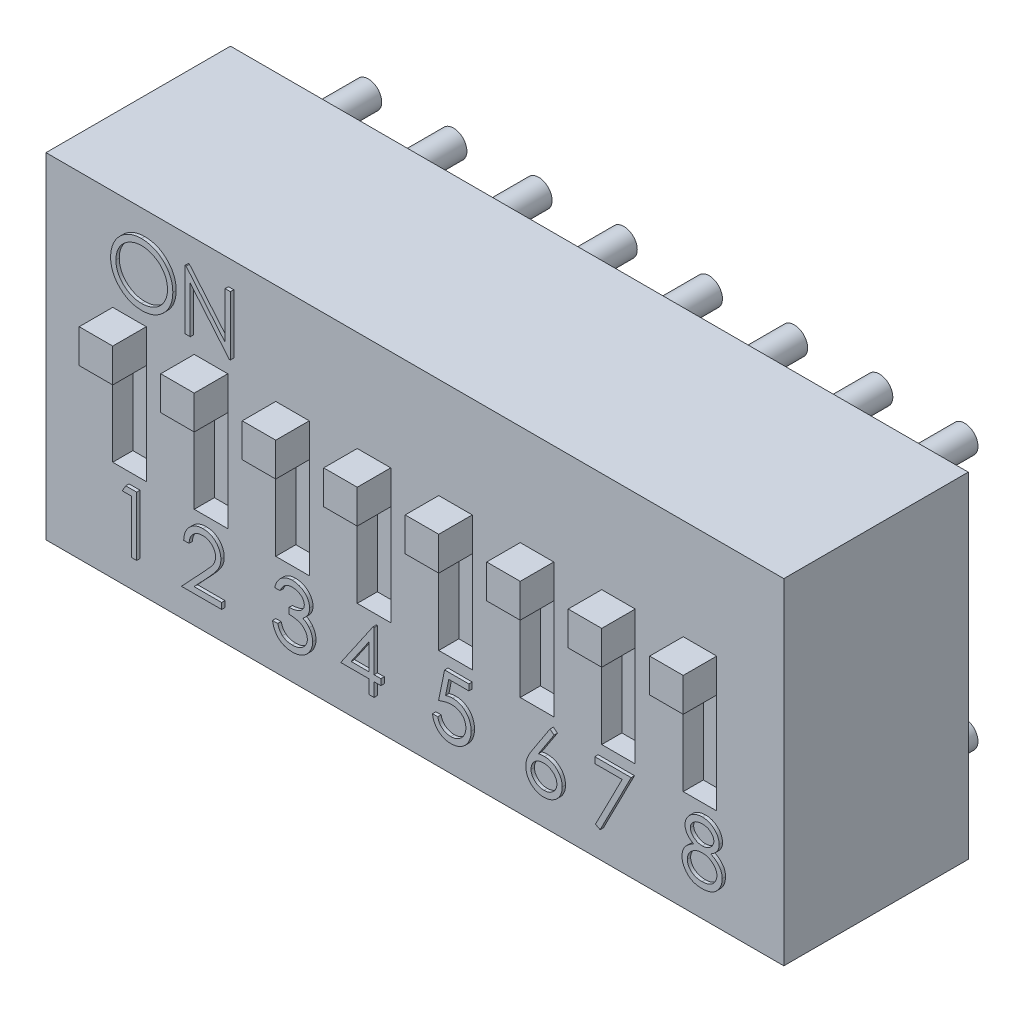
from build123d import *

# Parameters (mm, degrees)
SKETCH_1_W          = 22
SKETCH_1_H          = 10
EXTRUDE_1_DEPTH     = 5.5
SKETCH_42_W         = 1
SKETCH_42_H         = 4
CUT_EXTRUDE_1_DEPTH = 0.6
SKETCH_43_W         = 1
SKETCH_43_H         = 1.00419659
EXTRUDE_42_DEPTH    = 1.6
WRAP_1_DEPTH        = 0.1
SKETCH_45_R         = 0.4
EXTRUDE_43_DEPTH    = 2


# Read off the part's stored shape, not the designer's step: 包覆1
with BuildPart() as part:
    # 草图1 → 凸台-拉伸1 (new body)
    with BuildSketch(Plane.XY.offset(6.5)):
        with Locations((11, 5)):
            Rectangle(SKETCH_1_W, SKETCH_1_H)
    extrude(amount=-EXTRUDE_1_DEPTH)

    # 草图42 → 切除-拉伸1 (cut)
    with BuildSketch(Plane.XY.offset(6.5)):
        with Locations((12.21, 5)):
            Rectangle(SKETCH_42_W, SKETCH_42_H)
        with Locations((17.07, 5)):
            Rectangle(SKETCH_42_W, SKETCH_42_H)
        with Locations((19.5, 5)):
            Rectangle(SKETCH_42_W, SKETCH_42_H)
        with Locations((2.49, 5)):
            Rectangle(SKETCH_42_W, SKETCH_42_H)
        with Locations((4.92, 5)):
            Rectangle(SKETCH_42_W, SKETCH_42_H)
        with Locations((7.35, 5)):
            Rectangle(SKETCH_42_W, SKETCH_42_H)
        with Locations((9.78, 5)):
            Rectangle(SKETCH_42_W, SKETCH_42_H)
        with Locations((14.64, 5)):
            Rectangle(SKETCH_42_W, SKETCH_42_H)
    extrude(amount=-CUT_EXTRUDE_1_DEPTH, mode=Mode.SUBTRACT)

    # 草图43 → 凸台-拉伸42 (add)
    with BuildSketch(Plane.XY.offset(5.9)):
        with Locations((2.49, 6.497901705)):
            Rectangle(SKETCH_43_W, SKETCH_43_H)
        with Locations((4.92, 6.497901705)):
            Rectangle(SKETCH_43_W, SKETCH_43_H)
        with Locations((7.35, 6.497901705)):
            Rectangle(SKETCH_43_W, SKETCH_43_H)
        with Locations((9.78, 6.497901705)):
            Rectangle(SKETCH_43_W, SKETCH_43_H)
        with Locations((12.21, 6.497901705)):
            Rectangle(SKETCH_43_W, SKETCH_43_H)
        with Locations((14.64, 6.497901705)):
            Rectangle(SKETCH_43_W, SKETCH_43_H)
        with Locations((17.07, 6.497901705)):
            Rectangle(SKETCH_43_W, SKETCH_43_H)
        with Locations((19.5, 6.497901705)):
            Rectangle(SKETCH_43_W, SKETCH_43_H)
    extrude(amount=EXTRUDE_42_DEPTH)

    # 包覆1 outline → 包覆1 (add)
    # profile 1 of 10: a face of its own
    with BuildSketch(Plane.XY.offset(6.5)):
        with BuildLine():
            add(Edge.make_bspline(
                [(3.880857562, 8.378376083), (3.880076445, 8.346647529), (3.878536774, 8.284106873), (3.865348541, 8.192312359), (3.844665179, 8.104072207), (3.815134522, 8.019533723), (3.777223268, 7.938607728), (3.730528004, 7.86150716), (3.675524298, 7.788206742), (3.612927988, 7.719509487), (3.544690162, 7.65651473), (3.471498718, 7.601623074), (3.394999703, 7.554389091), (3.3142087, 7.516700493), (3.230197173, 7.486577343), (3.142213225, 7.466039311), (3.050669128, 7.452791475), (2.988242074, 7.451270239), (2.956511943, 7.450497032)],
                knots=[0, 0, 0, 0, 0.065226504, 0.128568996, 0.190320378, 0.251377989, 0.312387528, 0.373788704, 0.43643116, 0.500566755, 0.564686795, 0.627135518, 0.688455409, 0.749245746, 0.810155177, 0.871670926, 0.934773496, 1, 1, 1, 1], degree=3))
            add(Edge.make_bspline(
                [(2.942378217, 9.304841762), (2.975039445, 9.304014508), (3.039188792, 9.302389714), (3.133468601, 9.289952229), (3.22347486, 9.268435108), (3.309940763, 9.23977797), (3.391832065, 9.201549768), (3.469765157, 9.155343364), (3.543554614, 9.100674672), (3.612205865, 9.037966292), (3.675029011, 8.969737329), (3.730377771, 8.896925049), (3.776764165, 8.819969701), (3.814857002, 8.739102536), (3.844741619, 8.654506441), (3.865363518, 8.565730416), (3.878536316, 8.473349663), (3.880076331, 8.410340092), (3.880857562, 8.378376083)],
                knots=[0, 0, 0, 0, 0.066570035, 0.130749041, 0.1934128, 0.254989399, 0.316113556, 0.377261758, 0.439400784, 0.502970589, 0.566524976, 0.628231103, 0.689090611, 0.749344669, 0.810169593, 0.871609824, 0.934869184, 1, 1, 1, 1], degree=3))
            add(Edge.make_bspline(
                [(2.026512833, 8.369895848), (2.026782272, 8.390877392), (2.027317752, 8.432575787), (2.033764359, 8.494496653), (2.043118867, 8.555421707), (2.056525386, 8.615177701), (2.074059282, 8.673618356), (2.0947482, 8.731146716), (2.120017091, 8.787179783), (2.148582338, 8.841983001), (2.180464281, 8.894702064), (2.21567944, 8.944534235), (2.252990916, 8.991897674), (2.293894689, 9.035565013), (2.33704266, 9.076806578), (2.383134779, 9.114988582), (2.431889799, 9.150455324), (2.483517506, 9.182417162), (2.536745764, 9.211324345), (2.591616203, 9.236130595), (2.647383603, 9.257421269), (2.704309159, 9.274677558), (2.762241707, 9.288300846), (2.821307686, 9.297577568), (2.88146004, 9.304040617), (2.921984792, 9.304573565), (2.942378217, 9.304841762)],
                knots=[0, 0, 0, 0, 0.043208986, 0.085872872, 0.128120007, 0.170151964, 0.211917621, 0.253753003, 0.296006409, 0.338443357, 0.381015368, 0.422820479, 0.464089056, 0.505125849, 0.545974971, 0.586985211, 0.628338592, 0.670083802, 0.711991602, 0.753039155, 0.794049395, 0.834885543, 0.875498313, 0.9165473, 0.958003779, 1, 1, 1, 1], degree=3))
            add(Edge.make_bspline(
                [(2.956511943, 7.450497032), (2.924548099, 7.451277874), (2.861538855, 7.452817121), (2.769042016, 7.466011718), (2.680203629, 7.486644835), (2.595277746, 7.516131734), (2.514217008, 7.554240418), (2.436862879, 7.600708497), (2.363525848, 7.655846223), (2.294813936, 7.718422235), (2.231944301, 7.786544406), (2.177133028, 7.859536273), (2.130654499, 7.935965809), (2.092673772, 8.016045116), (2.062604778, 8.099387074), (2.042090842, 8.186547616), (2.028818358, 8.277029827), (2.027288892, 8.338636367), (2.026512833, 8.369895848)],
                knots=[0, 0, 0, 0, 0.065818877, 0.129746527, 0.192071954, 0.253459424, 0.314569588, 0.376279881, 0.439025654, 0.503267029, 0.567492823, 0.629704796, 0.690999649, 0.751451651, 0.812004364, 0.873149681, 0.935635484, 1, 1, 1, 1], degree=3))
        make_face()
        with BuildLine():
            add(Edge.make_bspline(
                [(2.184810554, 8.370602534), (2.185453044, 8.34512078), (2.18671702, 8.294990287), (2.197782938, 8.22152777), (2.21482814, 8.150927721), (2.23995467, 8.083576441), (2.2713774, 8.018894997), (2.310196507, 7.957457182), (2.35618819, 7.899246393), (2.408431316, 7.844669015), (2.465542363, 7.794853868), (2.526186238, 7.751127864), (2.589713255, 7.714131429), (2.656289075, 7.683991571), (2.725558272, 7.660108647), (2.797967196, 7.643740448), (2.873033499, 7.632967897), (2.924201726, 7.631933374), (2.950151766, 7.631408713)],
                knots=[0, 0, 0, 0, 0.064503999, 0.126899322, 0.18774654, 0.248149733, 0.308586065, 0.369583005, 0.431826965, 0.496179723, 0.560667855, 0.623504455, 0.685260411, 0.746536822, 0.808327352, 0.870486188, 0.934316883, 1, 1, 1, 1], degree=3))
            add(Edge.make_bspline(
                [(2.950151766, 9.123930081), (2.933412645, 9.123726029), (2.900094431, 9.123319876), (2.850562145, 9.117969892), (2.801681289, 9.110344909), (2.753441769, 9.099468507), (2.706045425, 9.084649798), (2.659050465, 9.067595055), (2.612885434, 9.046820934), (2.567702736, 9.023349769), (2.523900297, 8.99737075), (2.482568499, 8.968658788), (2.443600342, 8.937887215), (2.407091235, 8.904984217), (2.373148382, 8.869782235), (2.341103711, 8.832814936), (2.31224166, 8.79302569), (2.285790596, 8.751493461), (2.262120295, 8.708272346), (2.241071882, 8.663817376), (2.223854307, 8.617765923), (2.209812553, 8.570617597), (2.198170982, 8.522447072), (2.190795949, 8.472888926), (2.18538718, 8.422192183), (2.185004242, 8.387931487), (2.184810554, 8.370602534)],
                knots=[0, 0, 0, 0, 0.042023329, 0.083644911, 0.124983795, 0.166247461, 0.207701556, 0.249631071, 0.29174177, 0.334742875, 0.377460169, 0.419556319, 0.461044176, 0.502096284, 0.542890714, 0.583800819, 0.624863583, 0.666224689, 0.707399186, 0.748556678, 0.789654591, 0.830739726, 0.872070142, 0.913993395, 0.95649813, 1, 1, 1, 1], degree=3))
            add(Edge.make_bspline(
                [(3.722559841, 8.378729426), (3.722357693, 8.395821764), (3.721956695, 8.429727564), (3.716643622, 8.479852659), (3.709033253, 8.52886519), (3.698065539, 8.576572741), (3.683929152, 8.622987474), (3.666498236, 8.668065796), (3.645943739, 8.71197564), (3.62235388, 8.75460848), (3.595837176, 8.795517971), (3.566861902, 8.834627123), (3.534927778, 8.871201481), (3.500947202, 8.906143966), (3.464071399, 8.938709331), (3.42446741, 8.968908379), (3.382616032, 8.99746991), (3.338303497, 9.02323557), (3.292571425, 9.047030045), (3.245644946, 9.067416066), (3.198055678, 9.084738523), (3.149924637, 9.099513343), (3.100846707, 9.11030231), (3.051153508, 9.117976764), (3.00091379, 9.123318014), (2.967126136, 9.123725411), (2.950151766, 9.123930081)],
                knots=[0, 0, 0, 0, 0.042915082, 0.085129971, 0.126473319, 0.167453038, 0.207976333, 0.248249378, 0.288749987, 0.329669857, 0.370537287, 0.411128564, 0.451818913, 0.492405877, 0.533485862, 0.575263062, 0.617440613, 0.660671688, 0.703940204, 0.746867522, 0.7890793, 0.831104042, 0.87323799, 0.91516577, 0.957380658, 1, 1, 1, 1], degree=3))
            add(Edge.make_bspline(
                [(2.950151766, 7.631408713), (2.967593856, 7.631648352), (3.00218676, 7.632123629), (3.053639662, 7.63691066), (3.10416561, 7.644587039), (3.153693735, 7.655639393), (3.202167826, 7.669471914), (3.249790207, 7.685905174), (3.296053631, 7.706407209), (3.341541724, 7.729059549), (3.385082687, 7.754882962), (3.426647737, 7.782620442), (3.465189203, 7.813346692), (3.501670997, 7.845760827), (3.535753206, 7.880516417), (3.567205352, 7.917568275), (3.59592153, 7.957150273), (3.62236255, 7.998619505), (3.645949909, 8.041958887), (3.66650128, 8.086575034), (3.683936624, 8.132358085), (3.698011704, 8.179374075), (3.709041282, 8.227533709), (3.716641083, 8.276901471), (3.721957161, 8.3273786), (3.722357855, 8.361519353), (3.722559841, 8.378729426)],
                knots=[0, 0, 0, 0, 0.043633218, 0.086537777, 0.129177336, 0.171436324, 0.213415895, 0.255265955, 0.297369481, 0.339940748, 0.382347459, 0.423952947, 0.464871163, 0.505572294, 0.546002577, 0.586567975, 0.627064799, 0.668270684, 0.709549225, 0.750428154, 0.791096194, 0.832027145, 0.873135955, 0.914610764, 0.956955986, 1, 1, 1, 1], degree=3))
        make_face(mode=Mode.SUBTRACT)
    # profile 2 of 10: a face of its own
    with BuildSketch(Plane.XY.offset(6.5)):
        with BuildLine():
            add(Edge.make_bspline(
                [(4.206196581, 2.142210375), (4.207228281, 2.16321118), (4.209254513, 2.204456201), (4.218743373, 2.264591662), (4.23232072, 2.32207166), (4.251517603, 2.376434672), (4.275358466, 2.428161372), (4.303948598, 2.477046301), (4.337812166, 2.522902971), (4.376217941, 2.565306277), (4.417930707, 2.604206363), (4.462938066, 2.637798489), (4.51023298, 2.666180807), (4.559671963, 2.689908259), (4.611812802, 2.707718419), (4.666182338, 2.720933293), (4.723019442, 2.72888407), (4.761744374, 2.729738693), (4.781439192, 2.730173338)],
                knots=[0, 0, 0, 0, 0.068790794, 0.135103289, 0.198978674, 0.2619043, 0.323494969, 0.385195378, 0.446969239, 0.509764777, 0.572250569, 0.633405176, 0.693251163, 0.752583163, 0.812579266, 0.873275085, 0.935549943, 1, 1, 1, 1], degree=3))
            Line((4.206196581, 2.142210375), (4.364494302, 2.142210375))
            add(Edge.make_bspline(
                [(4.7733123, 2.549261657), (4.759518269, 2.548901304), (4.73242907, 2.548193629), (4.692656383, 2.543243318), (4.654714741, 2.534703152), (4.618508703, 2.523022844), (4.583977006, 2.508176671), (4.551287587, 2.489685196), (4.52051383, 2.467619706), (4.491597884, 2.442602441), (4.464956116, 2.414749325), (4.441548365, 2.383699859), (4.421095311, 2.350020964), (4.403250181, 2.313803511), (4.388758226, 2.274718868), (4.377684456, 2.232905779), (4.368922037, 2.188545797), (4.365994727, 2.157912044), (4.364494302, 2.142210375)],
                knots=[0, 0, 0, 0, 0.064438672, 0.126546911, 0.186887153, 0.245877536, 0.304040885, 0.362191218, 0.420975933, 0.480660283, 0.540600275, 0.600689098, 0.66193579, 0.724442506, 0.789038394, 0.856313757, 0.926352028, 1, 1, 1, 1], degree=3))
            add(Edge.make_bspline(
                [(5.155982906, 2.191678413), (5.155662512, 2.20371388), (5.155031077, 2.227433473), (5.149458349, 2.262210185), (5.141036784, 2.295756738), (5.128969134, 2.32817632), (5.113040341, 2.359142978), (5.093650978, 2.388694407), (5.071279796, 2.417263845), (5.045400386, 2.44405142), (5.016970771, 2.468585202), (4.986937161, 2.490318372), (4.95516191, 2.50848094), (4.921778991, 2.523369925), (4.886881473, 2.535049581), (4.850401859, 2.543142595), (4.812440947, 2.548223847), (4.786520098, 2.548911347), (4.7733123, 2.549261657)],
                knots=[0, 0, 0, 0, 0.061965401, 0.122121906, 0.180988497, 0.239933216, 0.299905831, 0.359988847, 0.421775742, 0.486575826, 0.551534805, 0.615017543, 0.677258617, 0.739729962, 0.803050103, 0.866495132, 0.931973474, 1, 1, 1, 1], degree=3))
            add(Edge.make_bspline(
                [(4.822426994, 1.651063429), (4.83908208, 1.66844948), (4.871073091, 1.701844527), (4.91632066, 1.750599908), (4.95696015, 1.795830827), (4.99325463, 1.837451825), (5.024416753, 1.876071703), (5.052070616, 1.910439669), (5.074227878, 1.942065919), (5.098274923, 1.97872488), (5.121565303, 2.023483468), (5.141579069, 2.078181002), (5.153782584, 2.13448799), (5.155246529, 2.17253862), (5.155982906, 2.191678413)],
                knots=[0, 0, 0, 0, 0.110802644, 0.212829202, 0.30610131, 0.390647321, 0.466924469, 0.534481039, 0.593586941, 0.644557005, 0.736200453, 0.825024026, 0.911985585, 1, 1, 1, 1], degree=3))
            Line((4.822426994, 1.651063429), (4.138354701, 0.921056529))
            Line((4.138354701, 0.921056529), (5.336894587, 0.921056529))
            Line((5.336894587, 0.921056529), (5.336894587, 1.10196821))
            Line((5.336894587, 1.10196821), (4.516078503, 1.10196821))
            Line((4.516078503, 1.10196821), (4.957404069, 1.572974598))
            add(Edge.make_bspline(
                [(5.314280627, 2.205812138), (5.313427276, 2.181244777), (5.31173555, 2.132541177), (5.297264415, 2.060970195), (5.274663198, 1.99162748), (5.247450244, 1.935819395), (5.219997861, 1.890848547), (5.195259316, 1.853822652), (5.166298875, 1.813956007), (5.132695029, 1.771382111), (5.095142907, 1.725767488), (5.053302372, 1.677139694), (5.006875062, 1.626001144), (4.97428923, 1.591073321), (4.957404069, 1.572974598)],
                knots=[0, 0, 0, 0, 0.098702196, 0.195672309, 0.292422427, 0.391342544, 0.444462441, 0.504228775, 0.570352338, 0.642545753, 0.722287505, 0.807921123, 0.900469538, 1, 1, 1, 1], degree=3))
            add(Edge.make_bspline(
                [(4.781439192, 2.730173338), (4.800780523, 2.729720545), (4.838785547, 2.728830822), (4.894253308, 2.721190144), (4.947057738, 2.70922312), (4.997095621, 2.692433208), (5.043967725, 2.669863278), (5.088026164, 2.642751026), (5.129795461, 2.611394207), (5.167394912, 2.57447661), (5.201920809, 2.535065091), (5.231706469, 2.492989838), (5.257213897, 2.449533015), (5.278475148, 2.404363247), (5.294126456, 2.357055229), (5.306009125, 2.30829771), (5.312725718, 2.257586), (5.313756547, 2.223262458), (5.314280627, 2.205812138)],
                knots=[0, 0, 0, 0, 0.06947546, 0.136516798, 0.200788824, 0.263829673, 0.325735023, 0.387290692, 0.449509219, 0.51296782, 0.576275215, 0.6375801, 0.697902606, 0.757172088, 0.816598528, 0.876653171, 0.937289642, 1, 1, 1, 1], degree=3))
        make_face()
    # profile 3 of 10: a face of its own
    with BuildSketch(Plane.XY.offset(6.5)):
        with BuildLine():
            add(Edge.make_bspline(
                [(6.919871795, 2.277894136), (6.924160338, 2.295650189), (6.93254409, 2.330361822), (6.950030565, 2.379955957), (6.96908019, 2.426887255), (6.991954858, 2.470276943), (7.016905698, 2.510997025), (7.045492149, 2.548123925), (7.076395343, 2.582601888), (7.110576964, 2.613199432), (7.146423551, 2.640906463), (7.184440205, 2.664530003), (7.22386206, 2.684852096), (7.26496225, 2.701594039), (7.307863138, 2.714206108), (7.352176877, 2.723356562), (7.398019593, 2.729298909), (7.429138419, 2.729878857), (7.444939681, 2.730173338)],
                knots=[0, 0, 0, 0, 0.072625346, 0.141976611, 0.208984928, 0.27395687, 0.336889347, 0.398744953, 0.460115885, 0.520824923, 0.580994459, 0.640151928, 0.698622451, 0.757271081, 0.816426694, 0.876254048, 0.937165293, 1, 1, 1, 1], degree=3))
            Line((6.919871795, 2.277894136), (7.078169516, 2.277894136))
            add(Edge.make_bspline(
                [(7.44705974, 2.549261657), (7.426975764, 2.548560455), (7.387747089, 2.547190844), (7.331194333, 2.535194881), (7.278620701, 2.516055132), (7.238434944, 2.49320873), (7.208759996, 2.470655932), (7.187554555, 2.45095965), (7.16673033, 2.429070885), (7.14765731, 2.403641466), (7.128368441, 2.37639352), (7.110807888, 2.345941903), (7.093743678, 2.313080958), (7.083461441, 2.289850222), (7.078169516, 2.277894136)],
                knots=[0, 0, 0, 0, 0.122711942, 0.239684964, 0.351815855, 0.463766133, 0.520817793, 0.579448291, 0.640604145, 0.705297512, 0.773633881, 0.844669382, 0.920056508, 1, 1, 1, 1], degree=3))
            add(Edge.make_bspline(
                [(7.801816239, 2.272593989), (7.801607389, 2.281805392), (7.801191892, 2.300131042), (7.795951994, 2.326904391), (7.788077974, 2.352859232), (7.777252872, 2.377885192), (7.762763685, 2.401808703), (7.74542416, 2.424833727), (7.724777538, 2.446828806), (7.701118523, 2.467330396), (7.675712573, 2.486868861), (7.647868441, 2.503456289), (7.61842567, 2.517640507), (7.587351666, 2.529337359), (7.554545585, 2.538136286), (7.520161566, 2.544453952), (7.484134043, 2.548403881), (7.459554638, 2.548972567), (7.44705974, 2.549261657)],
                knots=[0, 0, 0, 0, 0.055274549, 0.109966094, 0.163247443, 0.218076185, 0.273300874, 0.3309093, 0.390994523, 0.454175953, 0.518861541, 0.583310532, 0.648516682, 0.715030887, 0.782502073, 0.852322685, 0.92492849, 1, 1, 1, 1], degree=3))
            add(Edge.make_bspline(
                [(7.349537037, 1.983912655), (7.37135945, 1.984282972), (7.414104196, 1.985008334), (7.476542992, 1.993781418), (7.536249781, 2.00591729), (7.591901353, 2.024506256), (7.642625109, 2.046096406), (7.686631417, 2.071220337), (7.723303749, 2.099147611), (7.752463892, 2.130309284), (7.774401241, 2.163729962), (7.790440937, 2.198562564), (7.799915705, 2.235112388), (7.801180497, 2.260056129), (7.801816239, 2.272593989)],
                knots=[0, 0, 0, 0, 0.110165553, 0.215787256, 0.318027435, 0.417573954, 0.511650488, 0.596162097, 0.672934533, 0.743669557, 0.810677001, 0.874058962, 0.936696302, 1, 1, 1, 1], degree=3))
            Line((7.349537037, 1.983912655), (7.349537037, 1.803000974))
            add(Edge.make_bspline(
                [(7.89227208, 1.429870632), (7.891500856, 1.446305711), (7.889962247, 1.479094092), (7.878215463, 1.52733271), (7.858893893, 1.573810382), (7.831844651, 1.617734134), (7.798917518, 1.658442624), (7.760432029, 1.694764363), (7.716068596, 1.724735401), (7.675237154, 1.745442779), (7.639069794, 1.759572575), (7.60811839, 1.768984165), (7.573467244, 1.776953745), (7.535535394, 1.784368263), (7.494037027, 1.790678625), (7.449017322, 1.795940968), (7.400467157, 1.800151644), (7.366856926, 1.802031997), (7.349537037, 1.803000974)],
                knots=[0, 0, 0, 0, 0.066909186, 0.13348544, 0.201035117, 0.27123434, 0.342879984, 0.41383613, 0.485976622, 0.560229557, 0.599884181, 0.64405484, 0.691891932, 0.744687524, 0.801491775, 0.862857698, 0.929328379, 1, 1, 1, 1], degree=3))
            add(Edge.make_bspline(
                [(7.443172966, 1.05674029), (7.459679691, 1.057050687), (7.491957168, 1.05765764), (7.53905545, 1.063239445), (7.583861981, 1.071368661), (7.625879289, 1.083924014), (7.665657759, 1.099436586), (7.702639781, 1.118914155), (7.737310835, 1.141766455), (7.769226844, 1.167740555), (7.797925572, 1.196175198), (7.823194295, 1.225915912), (7.844675772, 1.256837302), (7.862004003, 1.289110482), (7.875687019, 1.322601808), (7.885001965, 1.357405266), (7.891478721, 1.393236031), (7.89200618, 1.417592297), (7.89227208, 1.429870632)],
                knots=[0, 0, 0, 0, 0.076071737, 0.148751715, 0.218402794, 0.285759581, 0.350598024, 0.414964045, 0.478069339, 0.541760676, 0.604349859, 0.664075021, 0.721463623, 0.777587128, 0.832644447, 0.887843511, 0.943460343, 1, 1, 1, 1], degree=3))
            add(Edge.make_bspline(
                [(7.148484798, 1.152142934), (7.15836085, 1.144528813), (7.17808247, 1.129324075), (7.210219634, 1.109920477), (7.244018208, 1.093107579), (7.280210524, 1.080264605), (7.318015587, 1.069390149), (7.358044457, 1.062273856), (7.399943983, 1.057391325), (7.428553134, 1.056960467), (7.443172966, 1.05674029)],
                knots=[0, 0, 0, 0, 0.118271305, 0.236177533, 0.355662933, 0.475904165, 0.600127342, 0.728608116, 0.861313476, 1, 1, 1, 1], degree=3))
            add(Edge.make_bspline(
                [(7.010327635, 1.395949692), (7.014451754, 1.382368244), (7.022473524, 1.35595115), (7.03612819, 1.317931631), (7.05168482, 1.283078167), (7.068373506, 1.251135086), (7.085900739, 1.221787804), (7.105512625, 1.195812338), (7.125756599, 1.172067772), (7.141016432, 1.15869013), (7.148484798, 1.152142934)],
                knots=[0, 0, 0, 0, 0.149770386, 0.29131641, 0.425966373, 0.552159574, 0.671527414, 0.786121629, 0.895325073, 1, 1, 1, 1], degree=3))
            Line((7.010327635, 1.395949692), (6.852029915, 1.395949692))
            add(Edge.make_bspline(
                [(7.440346221, 0.875828609), (7.421488081, 0.876266161), (7.384381551, 0.877127117), (7.329830264, 0.883012761), (7.277759408, 0.893762407), (7.228098579, 0.908227962), (7.18080366, 0.926568244), (7.136018972, 0.949407429), (7.093468986, 0.976274734), (7.053555229, 1.007487296), (7.016282458, 1.042402892), (6.982641205, 1.081641361), (6.952070595, 1.124477354), (6.925389185, 1.171408419), (6.901381674, 1.221828052), (6.881635715, 1.276381859), (6.864256083, 1.33458214), (6.856175726, 1.375140366), (6.852029915, 1.395949692)],
                knots=[0, 0, 0, 0, 0.06554117, 0.128963168, 0.190377136, 0.250092362, 0.308548432, 0.366397963, 0.424542189, 0.483169996, 0.5422434, 0.601739352, 0.662506002, 0.724855513, 0.789127829, 0.8563464, 0.926295235, 1, 1, 1, 1], degree=3))
            add(Edge.make_bspline(
                [(8.050569801, 1.445064386), (8.049665423, 1.420365043), (8.047860923, 1.371082591), (8.031731886, 1.298271918), (8.006728387, 1.227098748), (7.971220328, 1.159025317), (7.92794583, 1.095333617), (7.876461782, 1.038346747), (7.817353155, 0.989361736), (7.751431261, 0.948434359), (7.680010327, 0.915717787), (7.60362104, 0.893010267), (7.523364069, 0.878220814), (7.468327058, 0.876634892), (7.440346221, 0.875828609)],
                knots=[0, 0, 0, 0, 0.079648251, 0.158921676, 0.239619495, 0.32260943, 0.406034637, 0.487602095, 0.569684627, 0.653036145, 0.737435718, 0.822477816, 0.909747655, 1, 1, 1, 1], degree=3))
            add(Edge.make_bspline(
                [(7.945273549, 1.75847974), (7.953761051, 1.746859365), (7.970597066, 1.723808907), (7.991378466, 1.686748883), (8.010231472, 1.649278092), (8.024922257, 1.610392201), (8.036298769, 1.570541913), (8.044430817, 1.5296588), (8.049482666, 1.48770948), (8.050206139, 1.459329777), (8.050569801, 1.445064386)],
                knots=[0, 0, 0, 0, 0.12813551, 0.254172712, 0.378111645, 0.501712263, 0.623986309, 0.747095614, 0.872874637, 1, 1, 1, 1], degree=3))
            add(Edge.make_bspline(
                [(7.754114917, 1.909003912), (7.77287854, 1.899943484), (7.810054702, 1.881992156), (7.860728977, 1.846787072), (7.906730129, 1.806138833), (7.932383987, 1.774417734), (7.945273549, 1.75847974)],
                knots=[0, 0, 0, 0, 0.2538796, 0.503008917, 0.750291081, 1, 1, 1, 1], degree=3))
            add(Edge.make_bspline(
                [(7.96011396, 2.271887303), (7.959527547, 2.253237053), (7.958380028, 2.216741409), (7.948636454, 2.16346113), (7.932239211, 2.113244927), (7.909525481, 2.065881405), (7.880123192, 2.02167087), (7.844506396, 1.980513854), (7.802423706, 1.94222781), (7.77053313, 1.920295377), (7.754114917, 1.909003912)],
                knots=[0, 0, 0, 0, 0.128067549, 0.250608319, 0.370630166, 0.490072247, 0.610374764, 0.73431307, 0.863216504, 1, 1, 1, 1], degree=3))
            add(Edge.make_bspline(
                [(7.444939681, 2.730173338), (7.467962333, 2.72947825), (7.513505446, 2.728103235), (7.580413807, 2.71554715), (7.644935259, 2.695678135), (7.706363571, 2.668225106), (7.763422066, 2.634364833), (7.814189906, 2.594065144), (7.857978958, 2.548103592), (7.89471541, 2.497337577), (7.923479397, 2.443082618), (7.944689594, 2.387242856), (7.957602107, 2.329950752), (7.959275563, 2.29126752), (7.96011396, 2.271887303)],
                knots=[0, 0, 0, 0, 0.090254249, 0.178539792, 0.266093034, 0.354630978, 0.441886153, 0.525746915, 0.608113634, 0.690197273, 0.770821484, 0.848326181, 0.92401174, 1, 1, 1, 1], degree=3))
        make_face()
    # profile 4 of 10: a face of its own
    with BuildSketch(Plane.XY.offset(6.5)):
        with BuildLine():
            add(Edge.make_bspline(
                [(12.014019654, 2.040094212), (12.032694638, 2.045249944), (12.068874466, 2.05523836), (12.122274873, 2.066328569), (12.17297015, 2.073013932), (12.205866864, 2.073926775), (12.221785412, 2.074368495)],
                knots=[0, 0, 0, 0, 0.275068369, 0.53290146, 0.77397346, 1, 1, 1, 1], degree=3))
            Line((12.014019654, 2.040094212), (12.109068955, 2.504033737))
            Line((12.109068955, 2.504033737), (12.709045584, 2.504033737))
            Line((12.709045584, 2.504033737), (12.709045584, 2.684945418))
            Line((12.709045584, 2.684945418), (11.98539886, 2.684945418))
            Line((11.98539886, 2.684945418), (11.804487179, 1.803000974))
            add(Edge.make_bspline(
                [(12.193164619, 1.893456814), (12.1794925, 1.893164215), (12.151263043, 1.892560071), (12.107960666, 1.888111797), (12.062456504, 1.880935644), (12.014924993, 1.871064797), (11.965223387, 1.858147548), (11.913456574, 1.842668415), (11.85951571, 1.824161693), (11.823170666, 1.810185538), (11.804487179, 1.803000974)],
                knots=[0, 0, 0, 0, 0.102203037, 0.211023342, 0.325099662, 0.446502097, 0.573787718, 0.70890071, 0.850357871, 1, 1, 1, 1], degree=3))
            add(Edge.make_bspline(
                [(12.618589744, 1.504072688), (12.618257891, 1.518221976), (12.617608336, 1.545917193), (12.612301263, 1.586435841), (12.603070091, 1.624774239), (12.590257262, 1.661117524), (12.573989415, 1.695499973), (12.554109726, 1.72795707), (12.530245117, 1.758061026), (12.502984522, 1.785825924), (12.473120351, 1.811450127), (12.440138782, 1.833294171), (12.404730009, 1.851670827), (12.367320648, 1.8675297), (12.327020877, 1.878919758), (12.284628765, 1.887471033), (12.239686535, 1.892417665), (12.208959244, 1.893104013), (12.193164619, 1.893456814)],
                knots=[0, 0, 0, 0, 0.065351382, 0.127916032, 0.188360206, 0.247216077, 0.305630129, 0.36376984, 0.422660914, 0.482687294, 0.543300221, 0.604117955, 0.664964891, 0.727413494, 0.791467625, 0.858055443, 0.927036815, 1, 1, 1, 1], degree=3))
            add(Edge.make_bspline(
                [(12.170904002, 1.05674029), (12.186002107, 1.057153936), (12.215730399, 1.057968408), (12.259480582, 1.064237275), (12.30171961, 1.073892083), (12.342030698, 1.08834078), (12.381119252, 1.105901412), (12.417996509, 1.128436391), (12.453729309, 1.154370606), (12.487206979, 1.184082876), (12.51786813, 1.21682554), (12.544959509, 1.25183994), (12.567525651, 1.289192478), (12.586542444, 1.328236488), (12.600982797, 1.369399887), (12.611284403, 1.412489765), (12.617333564, 1.457612553), (12.618165706, 1.488389546), (12.618589744, 1.504072688)],
                knots=[0, 0, 0, 0, 0.064207295, 0.12642469, 0.187680284, 0.248216424, 0.30830506, 0.369660991, 0.431698552, 0.495946892, 0.559758024, 0.622295408, 0.683910635, 0.745092408, 0.806740225, 0.869086618, 0.933290003, 1, 1, 1, 1], degree=3))
            add(Edge.make_bspline(
                [(11.781873219, 1.373335731), (11.785768167, 1.356515059), (11.793254472, 1.324184793), (11.809686735, 1.278761458), (11.82977787, 1.238283119), (11.853668157, 1.202214321), (11.882167577, 1.170762168), (11.914688361, 1.142732934), (11.951149317, 1.117446262), (11.991664952, 1.096368915), (12.034408052, 1.078392995), (12.079143907, 1.066422895), (12.124654431, 1.058006175), (12.155435991, 1.057163661), (12.170904002, 1.05674029)],
                knots=[0, 0, 0, 0, 0.094687252, 0.181994156, 0.264376949, 0.342179862, 0.418617611, 0.496509075, 0.577369092, 0.661510592, 0.746732551, 0.831257984, 0.915205616, 1, 1, 1, 1], degree=3))
            Line((11.781873219, 1.373335731), (11.623575499, 1.373335731))
            add(Edge.make_bspline(
                [(12.161717081, 0.875828609), (12.144141601, 0.876176769), (12.10956392, 0.876861734), (12.058904745, 0.884027399), (12.010163655, 0.894290166), (11.963733008, 0.909729874), (11.919196697, 0.929075852), (11.877154295, 0.953526462), (11.836531543, 0.981234185), (11.798979842, 1.013931823), (11.764127356, 1.049671076), (11.732928441, 1.088455284), (11.705142869, 1.129644328), (11.681215592, 1.173438239), (11.660805874, 1.219721943), (11.64477213, 1.268668852), (11.631831055, 1.320023219), (11.626356236, 1.355378361), (11.623575499, 1.373335731)],
                knots=[0, 0, 0, 0, 0.065421144, 0.128708372, 0.190236142, 0.250724402, 0.310637179, 0.370766408, 0.431614744, 0.493522974, 0.555883455, 0.617342367, 0.678668039, 0.74071136, 0.802985363, 0.86680258, 0.932347171, 1, 1, 1, 1], degree=3))
            add(Edge.make_bspline(
                [(12.776887464, 1.497359169), (12.776552288, 1.482984875), (12.775886464, 1.454430544), (12.772500509, 1.412024538), (12.765981318, 1.370516285), (12.757228537, 1.329900278), (12.745867874, 1.290253412), (12.732115057, 1.251462206), (12.715284519, 1.213768098), (12.696823469, 1.176814427), (12.676036554, 1.141436608), (12.652965639, 1.108351603), (12.628590967, 1.077063096), (12.602363761, 1.047906651), (12.574040243, 1.02107386), (12.543963435, 0.99640548), (12.512373334, 0.973484334), (12.478781208, 0.953240838), (12.443935592, 0.934612682), (12.407333276, 0.919330582), (12.369807447, 0.905667736), (12.330818005, 0.89477722), (12.290453267, 0.88624375), (12.248646693, 0.880447813), (12.205617546, 0.876226354), (12.176450377, 0.875962095), (12.161717081, 0.875828609)],
                knots=[0, 0, 0, 0, 0.044014471, 0.087434124, 0.130118399, 0.172553695, 0.214554756, 0.256298092, 0.298438225, 0.340849003, 0.382715189, 0.423924045, 0.464246243, 0.504073671, 0.543861906, 0.583566725, 0.623094319, 0.663229061, 0.703551259, 0.743937895, 0.784541255, 0.825750111, 0.867757363, 0.910745164, 0.954914447, 1, 1, 1, 1], degree=3))
            add(Edge.make_bspline(
                [(12.221785412, 2.074368495), (12.241482376, 2.07394217), (12.280211529, 2.073103909), (12.336877189, 2.065054604), (12.390969559, 2.052384885), (12.442375516, 2.034685257), (12.491190158, 2.012052177), (12.536964366, 1.983779588), (12.580385219, 1.95075287), (12.620673748, 1.912781376), (12.657223697, 1.870991513), (12.689359732, 1.826058777), (12.716655958, 1.778419836), (12.738609196, 1.727619529), (12.756139396, 1.67421948), (12.767807266, 1.617657821), (12.775576798, 1.558467697), (12.776444826, 1.517996743), (12.776887464, 1.497359169)],
                knots=[0, 0, 0, 0, 0.065807646, 0.129394274, 0.190894061, 0.251281069, 0.310814964, 0.370370987, 0.430768263, 0.492881251, 0.555103948, 0.616067051, 0.677256033, 0.738259805, 0.800762134, 0.864777582, 0.931045295, 1, 1, 1, 1], degree=3))
        make_face()
    # profile 5 of 10: a face of its own
    with BuildSketch(Plane.XY.offset(6.5)):
        with BuildLine():
            add(Edge.make_bspline(
                [(14.784583111, 1.921724264), (14.815612576, 1.926670138), (14.876139056, 1.936317625), (14.937404409, 1.93790913), (14.967261507, 1.938684734)],
                knots=[0, 0, 0, 0, 0.512659336, 1, 1, 1, 1], degree=3))
            Line((14.784583111, 1.921724264), (15.250642695, 2.634417351))
            Line((15.250642695, 2.634417351), (15.128739316, 2.730173338))
            Line((15.128739316, 2.730173338), (14.602258057, 1.925257695))
            add(Edge.make_bspline(
                [(14.405092593, 1.412910162), (14.405688003, 1.431075487), (14.406903718, 1.468165612), (14.415392252, 1.524339943), (14.42903205, 1.581818068), (14.444307452, 1.63057911), (14.460447343, 1.6705244), (14.473879376, 1.702729731), (14.490598017, 1.735871224), (14.508425078, 1.771085319), (14.528965246, 1.807464485), (14.551298927, 1.845616731), (14.576043592, 1.88493529), (14.593390262, 1.911617484), (14.602258057, 1.925257695)],
                knots=[0, 0, 0, 0, 0.09781819, 0.199726053, 0.305276357, 0.415811491, 0.474472231, 0.53727388, 0.603657421, 0.674298863, 0.749834485, 0.828598477, 0.912377778, 1, 1, 1, 1], degree=3))
            add(Edge.make_bspline(
                [(14.9393474, 0.875828609), (14.915612158, 0.876598776), (14.8685968, 0.878124342), (14.799435828, 0.891714319), (14.732981053, 0.913741311), (14.669698072, 0.944087396), (14.611076175, 0.982418155), (14.558630398, 1.028562637), (14.512622242, 1.08153447), (14.474333445, 1.141325439), (14.443964957, 1.20557633), (14.421190669, 1.272572437), (14.407887801, 1.34206965), (14.406028885, 1.389181176), (14.405092593, 1.412910162)],
                knots=[0, 0, 0, 0, 0.084334722, 0.167052318, 0.249566077, 0.332740482, 0.415914886, 0.49782801, 0.580372589, 0.664600121, 0.749466693, 0.832510234, 0.915639282, 1, 1, 1, 1], degree=3))
            add(Edge.make_bspline(
                [(15.490562678, 1.41609025), (15.489845478, 1.391406034), (15.488434199, 1.342833339), (15.474371572, 1.272087935), (15.452519687, 1.204690993), (15.421284981, 1.141718561), (15.382488303, 1.083256949), (15.335176977, 1.031456337), (15.28102887, 0.985257549), (15.21980338, 0.946625046), (15.153913077, 0.915075096), (15.084692031, 0.892414041), (15.012812477, 0.878462451), (14.964026027, 0.876713378), (14.9393474, 0.875828609)],
                knots=[0, 0, 0, 0, 0.085947943, 0.169125212, 0.250399107, 0.332289736, 0.413364288, 0.494172283, 0.576021735, 0.660756969, 0.745783126, 0.830043593, 0.914027546, 1, 1, 1, 1], degree=3))
            add(Edge.make_bspline(
                [(14.967261507, 1.938684734), (14.985188916, 1.938202884), (15.020478487, 1.937254377), (15.072289852, 1.929954976), (15.122076339, 1.918451844), (15.169631596, 1.901683684), (15.215126313, 1.880263846), (15.258821568, 1.854592273), (15.299895994, 1.823343378), (15.338878533, 1.788436039), (15.374270761, 1.749773115), (15.405605519, 1.708749425), (15.431926164, 1.665407711), (15.453281275, 1.619769926), (15.469864289, 1.571906418), (15.481953301, 1.521878427), (15.489099365, 1.469651455), (15.490069752, 1.434132692), (15.490562678, 1.41609025)],
                knots=[0, 0, 0, 0, 0.065230804, 0.128404896, 0.190067072, 0.250943366, 0.311545833, 0.372862802, 0.435023674, 0.499071725, 0.563091075, 0.625510106, 0.686680036, 0.747282503, 0.808563495, 0.870742104, 0.934340952, 1, 1, 1, 1], degree=3))
        make_face()
        with BuildLine():
            add(Edge.make_bspline(
                [(14.563390313, 1.406549985), (14.56370598, 1.394631146), (14.564324954, 1.371260077), (14.569945369, 1.3368193), (14.57853051, 1.303675874), (14.591301265, 1.272000664), (14.606534657, 1.241310853), (14.626645674, 1.21271807), (14.64892953, 1.184485733), (14.675566235, 1.15878261), (14.704153009, 1.134865978), (14.734694091, 1.113961247), (14.766524706, 1.096077343), (14.800074589, 1.082061432), (14.834867743, 1.070558716), (14.871194054, 1.062464241), (14.909078787, 1.057887944), (14.934741827, 1.057127862), (14.947827635, 1.05674029)],
                knots=[0, 0, 0, 0, 0.061841703, 0.121262373, 0.180745949, 0.239230902, 0.298307559, 0.358182798, 0.420359231, 0.484792416, 0.549938484, 0.613718278, 0.676680707, 0.73915417, 0.802199703, 0.866740178, 0.932049652, 1, 1, 1, 1], degree=3))
            add(Edge.make_bspline(
                [(14.934047253, 1.757773053), (14.920610328, 1.757380944), (14.894364111, 1.756615041), (14.855857199, 1.752167394), (14.819413616, 1.743791912), (14.784550537, 1.733124753), (14.75191975, 1.718457735), (14.721284105, 1.70064155), (14.69252513, 1.679665798), (14.665944054, 1.65582764), (14.641844462, 1.629728116), (14.62109048, 1.601773238), (14.603188318, 1.572636715), (14.588632798, 1.542075101), (14.577298514, 1.510100079), (14.569099832, 1.476858711), (14.564537028, 1.442128089), (14.563777936, 1.418576391), (14.563390313, 1.406549985)],
                knots=[0, 0, 0, 0, 0.070599289, 0.137900921, 0.203196198, 0.266789725, 0.329106387, 0.390653545, 0.452653057, 0.51574804, 0.577926341, 0.638930012, 0.698350718, 0.757296037, 0.816393767, 0.87626691, 0.936817109, 1, 1, 1, 1], degree=3))
            add(Edge.make_bspline(
                [(15.332264957, 1.406549985), (15.331987627, 1.41859208), (15.331443318, 1.442226797), (15.325286868, 1.476843176), (15.316748449, 1.510268974), (15.303855414, 1.542294115), (15.28710525, 1.572792221), (15.266702899, 1.601917354), (15.24310077, 1.629892806), (15.215837327, 1.655878825), (15.186158519, 1.679639455), (15.154602252, 1.700614391), (15.121588313, 1.718316264), (15.087150175, 1.733086113), (15.050893246, 1.743744777), (15.013402877, 1.752137482), (14.974199568, 1.756603658), (14.947601833, 1.75737829), (14.934047253, 1.757773053)],
                knots=[0, 0, 0, 0, 0.061137915, 0.119993844, 0.178225322, 0.23625642, 0.294929377, 0.354715749, 0.416729664, 0.480664408, 0.54583177, 0.609758105, 0.672971228, 0.736016869, 0.799839398, 0.864775357, 0.931087623, 1, 1, 1, 1], degree=3))
            add(Edge.make_bspline(
                [(14.947827635, 1.05674029), (14.960913422, 1.057127893), (14.98657642, 1.057888034), (15.024461458, 1.062463899), (15.060786642, 1.070559971), (15.095583891, 1.082056883), (15.12911866, 1.096094218), (15.160921436, 1.113849987), (15.191173689, 1.134994539), (15.21977923, 1.158741739), (15.246305064, 1.184632025), (15.269123375, 1.212466052), (15.288618496, 1.241541944), (15.304460329, 1.271879769), (15.317090424, 1.303695027), (15.3257191, 1.336814169), (15.331327908, 1.371261421), (15.331948478, 1.3946316), (15.332264957, 1.406549985)],
                knots=[0, 0, 0, 0, 0.067962371, 0.133283403, 0.197835298, 0.260891987, 0.323376504, 0.386350075, 0.449637731, 0.514795327, 0.579239913, 0.641814178, 0.701358565, 0.760726766, 0.819222068, 0.878716169, 0.938147354, 1, 1, 1, 1], degree=3))
        make_face(mode=Mode.SUBTRACT)
    # profile 6 of 10: a face of its own
    with BuildSketch(Plane.XY.offset(6.5)):
        with BuildLine():
            add(Edge.make_bspline(
                [(20.262108262, 1.434817435), (20.261719491, 1.417834848), (20.260949966, 1.384219935), (20.254247196, 1.33460622), (20.244211687, 1.286420918), (20.229556536, 1.239674591), (20.210550185, 1.194625184), (20.187127335, 1.151234136), (20.160612957, 1.108790278), (20.13931917, 1.082674944), (20.12854456, 1.069460642)],
                knots=[0, 0, 0, 0, 0.128158186, 0.253673136, 0.377325306, 0.499384555, 0.622918368, 0.745839393, 0.871395285, 1, 1, 1, 1], degree=3))
            add(Edge.make_bspline(
                [(19.921132145, 1.903703765), (19.935570103, 1.896175509), (19.963728944, 1.881492897), (20.00383333, 1.857851329), (20.040484422, 1.832934652), (20.07469911, 1.807919755), (20.105876275, 1.781848644), (20.133667308, 1.754617649), (20.158758688, 1.726906478), (20.180644409, 1.698245884), (20.199894402, 1.668712009), (20.21653147, 1.638227336), (20.230752044, 1.606858672), (20.242022256, 1.574263603), (20.251306254, 1.540920931), (20.257694356, 1.506400123), (20.261129866, 1.47092865), (20.261779388, 1.446955736), (20.262108262, 1.434817435)],
                knots=[0, 0, 0, 0, 0.07952483, 0.155099976, 0.22721982, 0.295910504, 0.362055881, 0.425520117, 0.485812719, 0.544494706, 0.601459636, 0.657840594, 0.713974472, 0.769467952, 0.826129967, 0.882885359, 0.940700882, 1, 1, 1, 1], degree=3))
            add(Edge.make_bspline(
                [(20.171652422, 2.272593989), (20.170929449, 2.253454956), (20.169509571, 2.215866983), (20.157565554, 2.161072268), (20.137450511, 2.109757193), (20.109987182, 2.061339475), (20.074192592, 2.016697213), (20.03054454, 1.975262722), (19.979391017, 1.93669563), (19.940957951, 1.914931073), (19.921132145, 1.903703765)],
                knots=[0, 0, 0, 0, 0.121904041, 0.239412608, 0.355410104, 0.472090729, 0.592858982, 0.718703468, 0.854892383, 1, 1, 1, 1], degree=3))
            add(Edge.make_bspline(
                [(19.670965211, 2.730173338), (19.693393721, 2.729444427), (19.737620187, 2.728007098), (19.802629385, 2.716019266), (19.864831605, 2.69599685), (19.924012344, 2.66883436), (19.979112135, 2.635377449), (20.027796632, 2.594857961), (20.070801544, 2.549429481), (20.106373838, 2.498569205), (20.135686088, 2.444803758), (20.156097256, 2.388549551), (20.169176227, 2.33102205), (20.170825899, 2.292096548), (20.171652422, 2.272593989)],
                knots=[0, 0, 0, 0, 0.089409711, 0.176305764, 0.262625902, 0.349445726, 0.435498264, 0.51892813, 0.601354657, 0.684256422, 0.76580674, 0.844876866, 0.922279795, 1, 1, 1, 1], degree=3))
            add(Edge.make_bspline(
                [(19.154024217, 2.277540793), (19.154848418, 2.296337578), (19.156505208, 2.334122395), (19.169902357, 2.390368338), (19.191734296, 2.445611607), (19.221428608, 2.499584446), (19.258413435, 2.55046015), (19.302786099, 2.596089912), (19.353486967, 2.636060382), (19.410262955, 2.669612659), (19.471362169, 2.696919503), (19.535827633, 2.715757042), (19.602536144, 2.728072069), (19.647942534, 2.729466375), (19.670965211, 2.730173338)],
                knots=[0, 0, 0, 0, 0.074058426, 0.148870352, 0.226667668, 0.307734759, 0.391157204, 0.473929356, 0.557927752, 0.64498929, 0.733364056, 0.821092042, 0.909287215, 1, 1, 1, 1], degree=3))
            add(Edge.make_bspline(
                [(19.411611356, 1.903703765), (19.391154592, 1.914858985), (19.35154457, 1.936458615), (19.299096876, 1.976144505), (19.254046839, 2.019126857), (19.217632756, 2.066313301), (19.188970958, 2.116229781), (19.16930682, 2.168563988), (19.15600383, 2.222345521), (19.15468604, 2.25908793), (19.154024217, 2.277540793)],
                knots=[0, 0, 0, 0, 0.14586006, 0.282425903, 0.4108504, 0.535029421, 0.654701078, 0.770133433, 0.884555844, 1, 1, 1, 1], degree=3))
            add(Edge.make_bspline(
                [(19.063568376, 1.420330367), (19.06385961, 1.43270742), (19.06443519, 1.457168846), (19.068418983, 1.493308071), (19.074823644, 1.528483107), (19.083521862, 1.562823879), (19.095310197, 1.596080377), (19.109543336, 1.628410179), (19.126139994, 1.659849785), (19.145331692, 1.690571126), (19.167658506, 1.720143737), (19.192939393, 1.749069496), (19.221679628, 1.776899564), (19.25355948, 1.803973961), (19.288214625, 1.830772964), (19.326545206, 1.855848271), (19.367535095, 1.880975103), (19.396667184, 1.895997552), (19.411611356, 1.903703765)],
                knots=[0, 0, 0, 0, 0.058853586, 0.116315459, 0.172674843, 0.228780387, 0.284580359, 0.340256506, 0.396629805, 0.453507263, 0.51231819, 0.572648444, 0.636021936, 0.702362946, 0.771483056, 0.844184477, 0.920069794, 1, 1, 1, 1], degree=3))
            add(Edge.make_bspline(
                [(19.660364917, 0.875828609), (19.636671662, 0.876409421), (19.590566993, 0.877539623), (19.52345965, 0.885197134), (19.460905564, 0.898616734), (19.402541016, 0.91698366), (19.348717865, 0.94087691), (19.299589477, 0.970615274), (19.254447038, 1.005001755), (19.214660522, 1.04502393), (19.179338171, 1.087890397), (19.148309827, 1.132114422), (19.122519716, 1.177700043), (19.100684235, 1.223967538), (19.083968605, 1.271565401), (19.07239134, 1.320248741), (19.065038789, 1.369932523), (19.064060519, 1.403462365), (19.063568376, 1.420330367)],
                knots=[0, 0, 0, 0, 0.078556433, 0.15286284, 0.223559693, 0.290374944, 0.355403073, 0.418291157, 0.480388564, 0.543072615, 0.604923944, 0.664398309, 0.721942555, 0.778374891, 0.833829941, 0.888861236, 0.94408894, 1, 1, 1, 1], degree=3))
            add(Edge.make_bspline(
                [(20.12854456, 1.069460642), (20.114515861, 1.054042351), (20.086631819, 1.023396298), (20.038864232, 0.983607596), (19.986440505, 0.950169607), (19.929563488, 0.922919089), (19.868385219, 0.901709152), (19.802918732, 0.886467883), (19.733036401, 0.877737929), (19.685005469, 0.876475998), (19.660364917, 0.875828609)],
                knots=[0, 0, 0, 0, 0.11928345, 0.237092882, 0.354796044, 0.474576301, 0.597460066, 0.724926155, 0.858883199, 1, 1, 1, 1], degree=3))
        make_face()
        with BuildLine():
            add(Edge.make_bspline(
                [(19.221866097, 1.41503022), (19.222553136, 1.399190041), (19.223916206, 1.367763497), (19.23472967, 1.321316235), (19.252084087, 1.276351655), (19.276287271, 1.233236187), (19.30625704, 1.192943872), (19.343110458, 1.157822941), (19.38455723, 1.126616482), (19.43199972, 1.101377483), (19.483822002, 1.081221345), (19.540010294, 1.067334015), (19.59975821, 1.058140903), (19.641012845, 1.057214518), (19.662131633, 1.05674029)],
                knots=[0, 0, 0, 0, 0.074898208, 0.148596294, 0.224471235, 0.302322742, 0.381918618, 0.461148696, 0.542417123, 0.626716083, 0.714596831, 0.80490292, 0.900127254, 1, 1, 1, 1], degree=3))
            add(Edge.make_bspline(
                [(19.672378584, 1.803000974), (19.656692176, 1.802721956), (19.625919271, 1.802174591), (19.580835819, 1.796081867), (19.537568549, 1.787600387), (19.496263343, 1.774733655), (19.456937644, 1.758003678), (19.419378562, 1.737877937), (19.383873429, 1.714087893), (19.350912531, 1.686935789), (19.320813869, 1.657675667), (19.294406789, 1.626700702), (19.271981452, 1.594586569), (19.253922631, 1.560925405), (19.239100051, 1.526429982), (19.22936647, 1.490241234), (19.223126481, 1.453054871), (19.222288567, 1.427775774), (19.221866097, 1.41503022)],
                knots=[0, 0, 0, 0, 0.071268693, 0.139811785, 0.206497432, 0.271535244, 0.336081831, 0.400528388, 0.464983843, 0.530050305, 0.594423409, 0.65558271, 0.714849106, 0.772115064, 0.828999211, 0.885122163, 0.942079353, 1, 1, 1, 1], degree=3))
            add(Edge.make_bspline(
                [(20.103810541, 1.431637347), (20.103354022, 1.443670769), (20.102453847, 1.467398574), (20.096740514, 1.502558689), (20.086703544, 1.536527568), (20.072931404, 1.56971388), (20.054596554, 1.601445209), (20.033004099, 1.6325482), (20.006951905, 1.662159582), (19.977513811, 1.690509357), (19.945431715, 1.716723637), (19.911329623, 1.739913453), (19.875470033, 1.75944329), (19.837928827, 1.775326603), (19.798789364, 1.787818701), (19.758080432, 1.796545412), (19.715754369, 1.802038466), (19.687000525, 1.802676513), (19.672378584, 1.803000974)],
                knots=[0, 0, 0, 0, 0.057339426, 0.113063332, 0.169181449, 0.22577456, 0.283826304, 0.343454279, 0.405906962, 0.47139226, 0.538002834, 0.603063556, 0.667601831, 0.732225443, 0.79700481, 0.86304799, 0.930356987, 1, 1, 1, 1], degree=3))
            add(Edge.make_bspline(
                [(19.662131633, 1.05674029), (19.678636779, 1.057057189), (19.710794095, 1.057674611), (19.757706458, 1.063124672), (19.801977322, 1.071767539), (19.843520836, 1.084338294), (19.882802057, 1.099684115), (19.919154977, 1.119425601), (19.95351479, 1.141878557), (19.984188376, 1.16851739), (20.012124953, 1.196981262), (20.036483398, 1.227113546), (20.057628672, 1.258095313), (20.074224828, 1.290626708), (20.087492425, 1.324083606), (20.097029295, 1.358774518), (20.102913737, 1.394805846), (20.103508871, 1.419247838), (20.103810541, 1.431637347)],
                knots=[0, 0, 0, 0, 0.076558933, 0.149161352, 0.218826846, 0.285567139, 0.350313106, 0.414125154, 0.477179161, 0.540368019, 0.60220239, 0.662033654, 0.719934407, 0.775907433, 0.831114864, 0.886667447, 0.942552362, 1, 1, 1, 1], degree=3))
        make_face(mode=Mode.SUBTRACT)
        with BuildLine():
            add(Edge.make_bspline(
                [(19.312321937, 2.275067391), (19.312668348, 2.265854595), (19.313352907, 2.247648785), (19.318647158, 2.220764162), (19.326537715, 2.194345322), (19.338960866, 2.169020458), (19.353861372, 2.143911066), (19.372251918, 2.1196447), (19.394169007, 2.096136906), (19.418877281, 2.073587632), (19.445795, 2.052471986), (19.474311561, 2.034141057), (19.504069068, 2.018803232), (19.534761778, 2.006038016), (19.566702503, 1.996114912), (19.599695527, 1.989075158), (19.633746396, 1.984699707), (19.656818355, 1.984177081), (19.668491809, 1.983912655)],
                knots=[0, 0, 0, 0, 0.05456395, 0.107826203, 0.161923709, 0.217509701, 0.274498333, 0.334814765, 0.397554947, 0.464754577, 0.53290121, 0.600097214, 0.665354161, 0.731083628, 0.796883494, 0.86329159, 0.930831218, 1, 1, 1, 1], degree=3))
            add(Edge.make_bspline(
                [(19.662131633, 2.549261657), (19.649758806, 2.548933352), (19.625552147, 2.548291043), (19.590058332, 2.544935301), (19.556306385, 2.538407291), (19.523943661, 2.529719528), (19.493413862, 2.517983121), (19.464302361, 2.504176906), (19.43710461, 2.487391707), (19.411492287, 2.468562849), (19.388435349, 2.447853329), (19.367971944, 2.426276574), (19.350974045, 2.403408817), (19.336539835, 2.379818889), (19.32606661, 2.354806655), (19.318222695, 2.329138958), (19.312920248, 2.302491443), (19.312522924, 2.284279789), (19.312321937, 2.275067391)],
                knots=[0, 0, 0, 0, 0.075243309, 0.147208812, 0.21644709, 0.284025042, 0.350655449, 0.415031318, 0.479629831, 0.544651634, 0.60804424, 0.667827565, 0.725114247, 0.780991708, 0.835527004, 0.889438155, 0.944072089, 1, 1, 1, 1], degree=3))
            add(Edge.make_bspline(
                [(20.013354701, 2.278600822), (20.013086641, 2.286980824), (20.012554582, 2.303613928), (20.00817003, 2.328176517), (20.000925066, 2.352180315), (19.991116292, 2.375823618), (19.978209768, 2.398774701), (19.962907182, 2.421394353), (19.944318564, 2.443173726), (19.923456076, 2.464620371), (19.89979708, 2.484468669), (19.873387172, 2.501923463), (19.84436175, 2.516746357), (19.812720128, 2.528785531), (19.778578837, 2.537827906), (19.742095127, 2.544599398), (19.70296479, 2.548416006), (19.676037892, 2.54897366), (19.662131633, 2.549261657)],
                knots=[0, 0, 0, 0, 0.050902438, 0.101034043, 0.151083817, 0.203061988, 0.256248434, 0.310846715, 0.3687691, 0.43001504, 0.492519647, 0.556048722, 0.621995683, 0.690192369, 0.761384855, 0.83635622, 0.915487005, 1, 1, 1, 1], degree=3))
            add(Edge.make_bspline(
                [(19.668491809, 1.983912655), (19.683484917, 1.984352552), (19.713323047, 1.985228002), (19.757309059, 1.993367681), (19.800077138, 2.006171456), (19.841170157, 2.023689376), (19.879524452, 2.045676432), (19.913713693, 2.072000215), (19.943446254, 2.102052899), (19.968413149, 2.13536663), (19.987770492, 2.170821597), (20.002840054, 2.206401903), (20.011639952, 2.242487155), (20.012787773, 2.266660982), (20.013354701, 2.278600822)],
                knots=[0, 0, 0, 0, 0.089689936, 0.17849401, 0.266837753, 0.356558176, 0.44533425, 0.530805835, 0.614076217, 0.697707086, 0.77914195, 0.855353591, 0.92855682, 1, 1, 1, 1], degree=3))
        make_face(mode=Mode.SUBTRACT)
    # profile 7 of 10: a face of its own
    with BuildSketch(Plane.XY.offset(6.5)):
        Polygon((4.275895178, 9.259613841), (4.242680924, 9.259613841), (4.242680924, 7.495724953), (4.400978645, 7.495724953), (4.400978645, 8.88083001), (5.563477532, 7.495724953), (5.599518531, 7.495724953), (5.599518531, 9.259613841), (5.44122081, 9.259613841), (5.44122081, 7.871328696), align=None)
    # profile 8 of 10: a face of its own
    with BuildSketch(Plane.XY.offset(6.5)):
        Polygon((2.804131054, 0.921056529), (2.804131054, 2.684945418), (2.477995348, 2.684945418), (2.374465812, 2.504033737), (2.645833333, 2.504033737), (2.645833333, 0.921056529), align=None)
    # profile 9 of 10: a face of its own
    with BuildSketch(Plane.XY.offset(6.5)):
        Polygon((9.724002849, 0.921056529), (9.88230057, 0.921056529), (9.88230057, 1.328107811), (10.085826211, 1.328107811), (10.085826211, 1.509019492), (9.88230057, 1.509019492), (9.88230057, 2.730173338), (9.850146345, 2.730173338), (8.887286325, 1.328107811), (9.724002849, 1.328107811), align=None)
        Polygon((9.724002849, 1.509019492), (9.198228276, 1.509019492), (9.724002849, 2.275067391), align=None, mode=Mode.SUBTRACT)
    # profile 10 of 10: a face of its own
    with BuildSketch(Plane.XY.offset(6.5)):
        Polygon((16.462962963, 2.504033737), (17.280598958, 2.504033737), (16.484516894, 0.951090695), (16.621260684, 0.875828609), (17.548433048, 2.684945418), (16.462962963, 2.684945418), align=None)
    extrude(amount=WRAP_1_DEPTH)

    # 草图45 → 凸台-拉伸43 (add)
    with BuildSketch(Plane(origin=(0, 0, 1), x_dir=(-1, 0, 0), z_dir=(0, 0, -1))):
        with Locations(Location((-9.73, 8.81, 0), (0, 0, 180))):
            Circle(SKETCH_45_R)
        with Locations(Location((-7.19, 8.81, 0), (0, 0, 180))):
            Circle(SKETCH_45_R)
        with Locations(Location((-4.65, 8.81, 0), (0, 0, 180))):
            Circle(SKETCH_45_R)
        with Locations(Location((-2.11, 8.81, 0), (0, 0, 180))):
            Circle(SKETCH_45_R)
        with Locations(Location((-14.81, 8.81, 0), (0, 0, 180))):
            Circle(SKETCH_45_R)
        with Locations(Location((-17.35, 8.81, 0), (0, 0, 180))):
            Circle(SKETCH_45_R)
        with Locations(Location((-19.89, 8.81, 0), (0, 0, 180))):
            Circle(SKETCH_45_R)
        with Locations(Location((-12.27, 8.81, 0), (0, 0, 180))):
            Circle(SKETCH_45_R)
        with Locations(Location((-2.11, 1.19, 0), (0, 0, 180))):
            Circle(SKETCH_45_R)
        with Locations(Location((-4.65, 1.19, 0), (0, 0, 180))):
            Circle(SKETCH_45_R)
        with Locations(Location((-7.19, 1.19, 0), (0, 0, 180))):
            Circle(SKETCH_45_R)
        with Locations(Location((-9.73, 1.19, 0), (0, 0, 180))):
            Circle(SKETCH_45_R)
        with Locations(Location((-12.27, 1.19, 0), (0, 0, 180))):
            Circle(SKETCH_45_R)
        with Locations(Location((-14.81, 1.19, 0), (0, 0, 180))):
            Circle(SKETCH_45_R)
        with Locations(Location((-17.35, 1.19, 0), (0, 0, 180))):
            Circle(SKETCH_45_R)
        with Locations(Location((-19.89, 1.19, 0), (0, 0, 180))):
            Circle(SKETCH_45_R)
    extrude(amount=EXTRUDE_43_DEPTH)


solid = part.part
